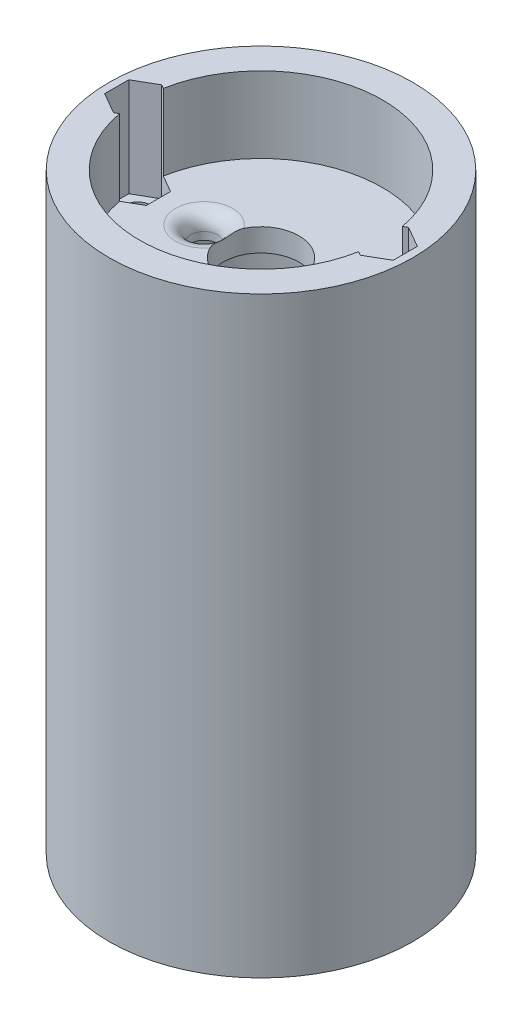
from build123d import *

# Parameters (mm, degrees)
SKETCH1_R                 = 20
SKETCH1_R_2               = 16
BOSS_EXTRUDE1_DEPTH       = 10
SKETCH2_R                 = 1.75
BOSS_EXTRUDE2_DEPTH       = 3
BOSS_EXTRUDE2_2_DEPTH     = 3
BOSS_EXTRUDE3_OUTLINE_R   = 16
BOSS_EXTRUDE3_OUTLINE_R_2 = 12.5
BOSS_EXTRUDE3_DEPTH       = 58
FILLET1_R                 = 5
BOSS_EXTRUDE4_START       = 10
SKETCH3_R                 = 20
SKETCH3_R_2               = 14.5
BOSS_EXTRUDE4_DEPTH       = 10
CUT_EXTRUDE1_DEPTH        = 25
CUT_EXTRUDE2_DEPTH        = 3
BOSS_EXTRUDE5_START       = 48
SKETCH5_R                 = 20
SKETCH5_R_2               = 12.5
BOSS_EXTRUDE5_DEPTH       = 48
SKETCH6_R                 = 1.75
BOSS_EXTRUDE7_DEPTH       = 3
SKETCH7_R                 = 5
CUT_EXTRUDE3_DEPTH        = 3
CUT_EXTRUDE4_DEPTH        = 62.846584384
CUT_EXTRUDE4_DEPTH_BACK   = 62.846584384
SKETCH9_R                 = 1.75
BOSS_EXTRUDE8_START       = 10
SKETCH10_R                = 20
SKETCH10_R_2              = 18
BOSS_EXTRUDE8_DEPTH       = 10
FILLET5_R                 = 2
CUT_EXTRUDE5_START        = 39.893559
CUT_EXTRUDE5_DEPTH        = 10


# Read off the part's stored shape, not the designer's step: Boss-Extrude3
with BuildPart() as part:
    # Sketch1 → Boss-Extrude1 (new body)
    with BuildSketch(Plane(origin=(0, 0, 0), x_dir=(1, 0, 0), z_dir=(0, 1, 0))):
        with Locations(Location((0, 0, 0), (0, 0, 270))):
            Circle(SKETCH1_R)
        with Locations(Location((0, 0, 0), (0, 0, 270))):
            Circle(SKETCH1_R_2, mode=Mode.SUBTRACT)
    extrude(amount=BOSS_EXTRUDE1_DEPTH)



with BuildPart() as body_2:
    # Sketch2 → Boss-Extrude2 (new body)
    with BuildSketch(Plane(origin=(0, 0, 0), x_dir=(-1, 0, 0), z_dir=(0, -1, 0))):
        with BuildLine():
            Line((-9.387458609, 2), (-15.874507866, 2))
            ThreePointArc((-15.874507866, 2), (-16, 0), (-15.874507866, -2))
            Line((-15.874507866, -2), (-9.387458609, -2))
            ThreePointArc((-9.387458609, -2), (-4.75, 0), (-9.387458609, 2))
        make_face()
        with Locations(Location((-7.5, 0, 0), (0, 0, 90))):
            Circle(SKETCH2_R, mode=Mode.SUBTRACT)
    extrude(amount=BOSS_EXTRUDE2_DEPTH)


with BuildPart() as body_3:
    # Sketch2 → Boss-Extrude2 2 (new body)
    with BuildSketch(Plane(origin=(0, 0, 0), x_dir=(-1, 0, 0), z_dir=(0, -1, 0))):
        with BuildLine():
            Line((9.387458609, -2), (15.874507866, -2))
            ThreePointArc((15.874507866, -2), (16, 0), (15.874507866, 2))
            Line((15.874507866, 2), (9.387458609, 2))
            ThreePointArc((9.387458609, 2), (4.75, 0), (9.387458609, -2))
        make_face()
        with Locations(Location((7.5, 0, 0), (0, 0, 90))):
            Circle(SKETCH2_R, mode=Mode.SUBTRACT)
    extrude(amount=BOSS_EXTRUDE2_2_DEPTH)


    add(body_2.part)  # Boss-Extrude3 merges body 2
    # Boss-Extrude3 outline → Boss-Extrude3 (add)
    with BuildSketch(Plane(origin=(0, 0, 0), x_dir=(-1, 0, 0), z_dir=(0, -1, 0))):
        Circle(BOSS_EXTRUDE3_OUTLINE_R)
        Circle(BOSS_EXTRUDE3_OUTLINE_R_2, mode=Mode.SUBTRACT)
    extrude(amount=BOSS_EXTRUDE3_DEPTH)

    # Fillet1
    # the kernel refuses this fillet: 5 mm, written as the material it adds along each edge
    with BuildSketch(Plane(origin=(-12.338962679, -3, 2), x_dir=(0.44041013703938037, 0, 0.8977966981410402), z_dir=(0, 1, 0)), Plane(origin=(12.338962679, -3, -2), x_dir=(-0.4404101370393726, 0, -0.897796698141044), z_dir=(0, 1, 0))) as fillet1_piece_1:
        with BuildLine():
            CenterArc((5.821777357, 4.78348009), FILLET1_R, 205.259956012, 81.663200185)
            Line((1.299872312, 2.649850609), (1.209434211, 2.607178019))
            ThreePointArc((1.209434211, 2.607178019), (0.560156486, 1.368966318), (-0.08977967, 0.044041014))
            Line((-0.08977967, 0.044041014), (-0.029108887, -0.095669602))
            ThreePointArc((-0.029108887, -0.095669602), (3.638610848, -0.641299774), (7.306330583, -0.095669602))
            Line((7.306330583, -0.095669602), (7.277221696, 0))
        make_face()
    extrude(amount=3)
    with BuildSketch(Plane(origin=(-12.338962679, -3, -2), x_dir=(0.44041013703938064, 0, -0.8977966981410401), z_dir=(0, 1, 0)), Plane(origin=(12.338962679, -3, 2), x_dir=(-0.44041013703937265, 0, 0.8977966981410441), z_dir=(0, 1, 0))) as fillet1_piece_2:
        with BuildLine():
            CenterArc((5.821777357, -4.78348009), FILLET1_R, 73.076843803, 81.663200185)
            Line((1.299872312, -2.649850609), (1.209434211, -2.607178019))
            ThreePointArc((1.209434211, -2.607178019), (0.560156486, -1.368966318), (-0.08977967, -0.044041014))
            Line((-0.08977967, -0.044041014), (-0.029108887, 0.095669602))
            ThreePointArc((-0.029108887, 0.095669602), (3.638610848, 0.641299774), (7.306330583, 0.095669602))
            Line((7.306330583, 0.095669602), (7.277221696, 0))
        make_face()
    extrude(amount=3)


with BuildPart() as part_1:
    add(part.part)

    add(body_3.part)  # Boss-Extrude4 merges body 3
    # Sketch3 → Boss-Extrude4 (add)
    with BuildSketch(Plane(origin=(0, 0, 0), x_dir=(-1, 0, 0), z_dir=(0, -1, 0)).offset(BOSS_EXTRUDE4_START)):
        with Locations(Location((0, 0, 0), (0, 0, 90))):
            Circle(SKETCH3_R)
        Circle(SKETCH3_R_2, mode=Mode.SUBTRACT)
    extrude(amount=-BOSS_EXTRUDE4_DEPTH)

    # Sketch4 → Cut-Extrude1 (cut)
    with BuildSketch(Plane(origin=(0, 0, 0), x_dir=(1, 0, 0), z_dir=(0, 1, 0))):
        Polygon((-16.25, 3.175426481), (-19, 1.58771324), (-19, -1.58771324), (-16.25, -3.175426481), (-13.5, -1.58771324), (-13.5, 1.58771324), align=None)
        Polygon((16.25, 3.175426481), (13.5, 1.58771324), (13.5, -1.58771324), (16.25, -3.175426481), (19, -1.58771324), (19, 1.58771324), align=None)
    extrude(amount=CUT_EXTRUDE1_DEPTH, mode=Mode.SUBTRACT)

    # Sketch4<3> → Cut-Extrude2 (cut)
    with BuildSketch(Plane(origin=(0, 0, 0), x_dir=(1, 0, 0), z_dir=(0, 1, 0))):
        Polygon((-16.25, 3.175426481), (-19, 1.58771324), (-19, -1.58771324), (-16.25, -3.175426481), (-13.5, -1.58771324), (-13.5, 1.58771324), align=None)
        Polygon((16.25, 3.175426481), (13.5, 1.58771324), (13.5, -1.58771324), (16.25, -3.175426481), (19, -1.58771324), (19, 1.58771324), align=None)
    extrude(amount=-CUT_EXTRUDE2_DEPTH, mode=Mode.SUBTRACT)

    # Sketch5 → Boss-Extrude5 (add)
    with BuildSketch(Plane(origin=(0, -10, 0), x_dir=(-1, 0, 0), z_dir=(0, -1, 0)).offset(BOSS_EXTRUDE5_START)):
        with Locations(Location((0, 0, 0), (0, 0, 90))):
            Circle(SKETCH5_R)
        with Locations(Location((0, 0, 0), (0, 0, 223.053208616))):
            Circle(SKETCH5_R_2, mode=Mode.SUBTRACT)
    extrude(amount=-BOSS_EXTRUDE5_DEPTH)

    # Sketch6 → Boss-Extrude7 (add)
    # profile 1 of 3: a face of its own
    with BuildSketch(Plane(origin=(0, 0, 0), x_dir=(1, 0, 0), z_dir=(0, 1, 0))):
        with BuildLine():
            ThreePointArc((9.387458609, 2), (4.75, 0), (9.387458609, -2))
            ThreePointArc((9.387458609, -2), (10.476642124, -5.313902708), (9.134000475, -8.533465611))
            ThreePointArc((9.134000475, -8.533465611), (0, -12.5), (-9.134000475, -8.533465611))
            ThreePointArc((-9.134000475, -8.533465611), (-10.476642124, -5.313902708), (-9.387458609, -2))
            ThreePointArc((-9.387458609, -2), (-4.75, 0), (-9.387458609, 2))
            ThreePointArc((-9.387458609, 2), (-10.476642124, 5.313902708), (-9.134000475, 8.533465611))
            ThreePointArc((-9.134000475, 8.533465611), (0, 12.5), (9.134000475, 8.533465611))
            ThreePointArc((9.134000475, 8.533465611), (10.476642124, 5.313902708), (9.387458609, 2))
        make_face()
    # profile 2 of 3: a face of its own
    with BuildSketch(Plane(origin=(0, 0, 0), x_dir=(1, 0, 0), z_dir=(0, 1, 0))):
        with BuildLine():
            ThreePointArc((-9.387458609, 2), (-10.476642124, 5.313902708), (-9.134000475, 8.533465611))
            ThreePointArc((-9.134000475, 8.533465611), (-12.5, 0), (-9.134000475, -8.533465611))
            ThreePointArc((-9.134000475, -8.533465611), (-10.476642124, -5.313902708), (-9.387458609, -2))
            ThreePointArc((-9.387458609, -2), (-4.75, 0), (-9.387458609, 2))
        make_face()
        with Locations(Location((-7.5, 0, 0), (0, 0, 90))):
            Circle(SKETCH6_R, mode=Mode.SUBTRACT)
    # profile 3 of 3: a face of its own
    with BuildSketch(Plane(origin=(0, 0, 0), x_dir=(1, 0, 0), z_dir=(0, 1, 0))):
        with BuildLine():
            ThreePointArc((9.134000475, -8.533465611), (11.628091114, -4.586665132), (12.5, 0))
            ThreePointArc((12.5, 0), (11.628091114, 4.586665132), (9.134000475, 8.533465611))
            ThreePointArc((9.134000475, 8.533465611), (10.476642124, 5.313902708), (9.387458609, 2))
            ThreePointArc((9.387458609, 2), (4.75, 0), (9.387458609, -2))
            ThreePointArc((9.387458609, -2), (10.476642124, -5.313902708), (9.134000475, -8.533465611))
        make_face()
        with Locations(Location((7.5, 0, 0), (0, 0, 90))):
            Circle(SKETCH6_R, mode=Mode.SUBTRACT)
    extrude(amount=-BOSS_EXTRUDE7_DEPTH)

    # Sketch7 → Cut-Extrude3 (cut)
    with BuildSketch(Plane(origin=(0, 0, 0), x_dir=(1, 0, 0), z_dir=(0, 1, 0))):
        with Locations(Location((0, 0, 0), (0, 0, 270))):
            Circle(SKETCH7_R)
    extrude(amount=-CUT_EXTRUDE3_DEPTH, mode=Mode.SUBTRACT)

    # Sketch9 → Cut-Extrude4 (cut, two sides: drawn at the far end of the back side and taken through both)
    with BuildSketch(Plane(origin=(0, -3, 0), x_dir=(1, 0, 0), z_dir=(0, 1, 0)).offset(-CUT_EXTRUDE4_DEPTH_BACK)):
        with Locations(Location((-16.25, 0, 0), (0, 0, 270))):
            Circle(SKETCH9_R)
        with Locations(Location((16.25, 0, 0), (0, 0, 270))):
            Circle(SKETCH9_R)
    extrude(amount=CUT_EXTRUDE4_DEPTH + CUT_EXTRUDE4_DEPTH_BACK, mode=Mode.SUBTRACT)

    # Sketch10 → Boss-Extrude8 (add)
    with BuildSketch(Plane(origin=(0, -58, 0), x_dir=(-1, 0, 0), z_dir=(0, -1, 0)).offset(BOSS_EXTRUDE8_START)):
        with Locations(Location((0, 0, 0), (0, 0, 90))):
            Circle(SKETCH10_R)
        Circle(SKETCH10_R_2, mode=Mode.SUBTRACT)
    extrude(amount=-BOSS_EXTRUDE8_DEPTH)

    # Fillet5
    # the kernel refuses this fillet: 2 mm, written as the material it takes off along each edge
    with BuildSketch(Plane(origin=(7.5, 0, 0), x_dir=(0, 0, -1), z_dir=(-1, 0, 0))) as fillet5_piece_1:
        with BuildLine():
            CenterArc((1.75 + FILLET5_R, FILLET5_R), FILLET5_R, 180, 90)
            Line((1.75 + FILLET5_R, 0), (1.75, 0))
            Line((1.75, 0), (1.75, FILLET5_R))
        make_face()
    revolve(axis=Axis((7.5, 0, 0), (0, -1, 0)), mode=Mode.SUBTRACT)
    with BuildSketch(Plane(origin=(-7.5, 0, 0), x_dir=(0, 0, -1), z_dir=(-1, 0, 0))) as fillet5_piece_2:
        with BuildLine():
            CenterArc((1.75 + FILLET5_R, FILLET5_R), FILLET5_R, 180, 90)
            Line((1.75 + FILLET5_R, 0), (1.75, 0))
            Line((1.75, 0), (1.75, FILLET5_R))
        make_face()
    revolve(axis=Axis((-7.5, 0, 0), (0, -1, 0)), mode=Mode.SUBTRACT)

    # Sketch11 → Cut-Extrude5 (cut)
    with BuildSketch(Plane(origin=(0, -107.893559475, 0), x_dir=(1, 0, 0), z_dir=(0, 1, 0)).offset(CUT_EXTRUDE5_START)):
        Polygon((16.25, 3.175426481), (13.5, 1.58771324), (13.5, -1.58771324), (16.25, -3.175426481), (19, -1.58771324), (19, 1.58771324), align=None)
        Polygon((-16.25, 3.175426481), (-19, 1.58771324), (-19, -1.58771324), (-16.25, -3.175426481), (-13.5, -1.58771324), (-13.5, 1.58771324), align=None)
    extrude(amount=CUT_EXTRUDE5_DEPTH, mode=Mode.SUBTRACT)


solid = part_1.part
